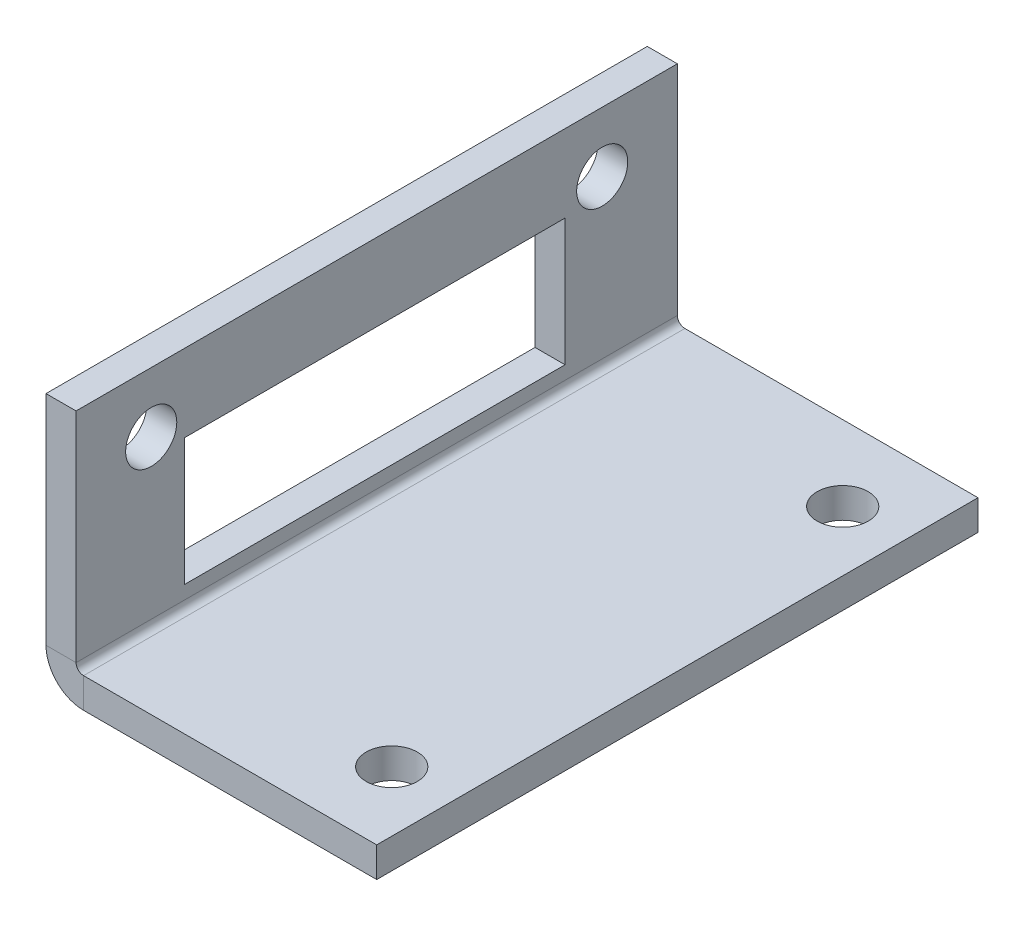
from build123d import *

# Parameters (mm, degrees)
SM_BASE_FLANGE_1_DEPTH = 40
SKETCH_6_R             = 1.7
CUT_EXTRUDE_1_DEPTH    = 10
SKETCH_7_R             = 1.7
CUT_EXTRUDE_2_DEPTH    = 10
SKETCH_11_W            = 25.332346726
SKETCH_11_H            = 8.454216192
CUT_EXTRUDE_5_DEPTH    = 10


# Sheet-metal steps are written as plain solids
with BuildPart() as part:
    # Sketch 1 → 基体-法兰1 (new body)
    with BuildSketch(Plane.XY):
        with BuildLine():
            Line((20, 0), (0.5, 0))
            ThreePointArc((0.5, 0), (0.146446609, 0.146446609), (0, 0.5))
            Line((0, 0.5), (0, 15))
            Line((0, 15), (-2, 15))
            Line((-2, 15), (-2, 0.5))
            ThreePointArc((-2, 0.5), (-1.267766953, -1.267766953), (0.5, -2))
            Line((0.5, -2), (20, -2))
            Line((20, -2), (20, 0))
        make_face()
    extrude(amount=SM_BASE_FLANGE_1_DEPTH)

    # 草图6 → 切除-拉伸1 (cut)
    with BuildSketch(Plane(origin=(0, 0, 0), x_dir=(0, 0, -1), z_dir=(1, 0, 0))):
        with Locations((-35, 11)):
            Circle(SKETCH_6_R)
        with Locations((-5, 11)):
            Circle(SKETCH_6_R)
    extrude(amount=-CUT_EXTRUDE_1_DEPTH, mode=Mode.SUBTRACT)

    # 草图7 → 切除-拉伸2 (cut)
    with BuildSketch(Plane(origin=(0, 0, 0), x_dir=(1, 0, 0), z_dir=(0, 1, 0))):
        with Locations(Location((16, -5, 0), (0, 0, 270))):
            Circle(SKETCH_7_R)
        with Locations(Location((16, -35, 0), (0, 0, 270))):
            Circle(SKETCH_7_R)
    extrude(amount=-CUT_EXTRUDE_2_DEPTH, mode=Mode.SUBTRACT)

    # 草图11 → 切除-拉伸5 (cut)
    with BuildSketch(Plane.ZY.offset(2)):
        with Locations((20.136358326, 5.621246346)):
            Rectangle(SKETCH_11_W, SKETCH_11_H)
    extrude(amount=-CUT_EXTRUDE_5_DEPTH, mode=Mode.SUBTRACT)


solid = part.part
